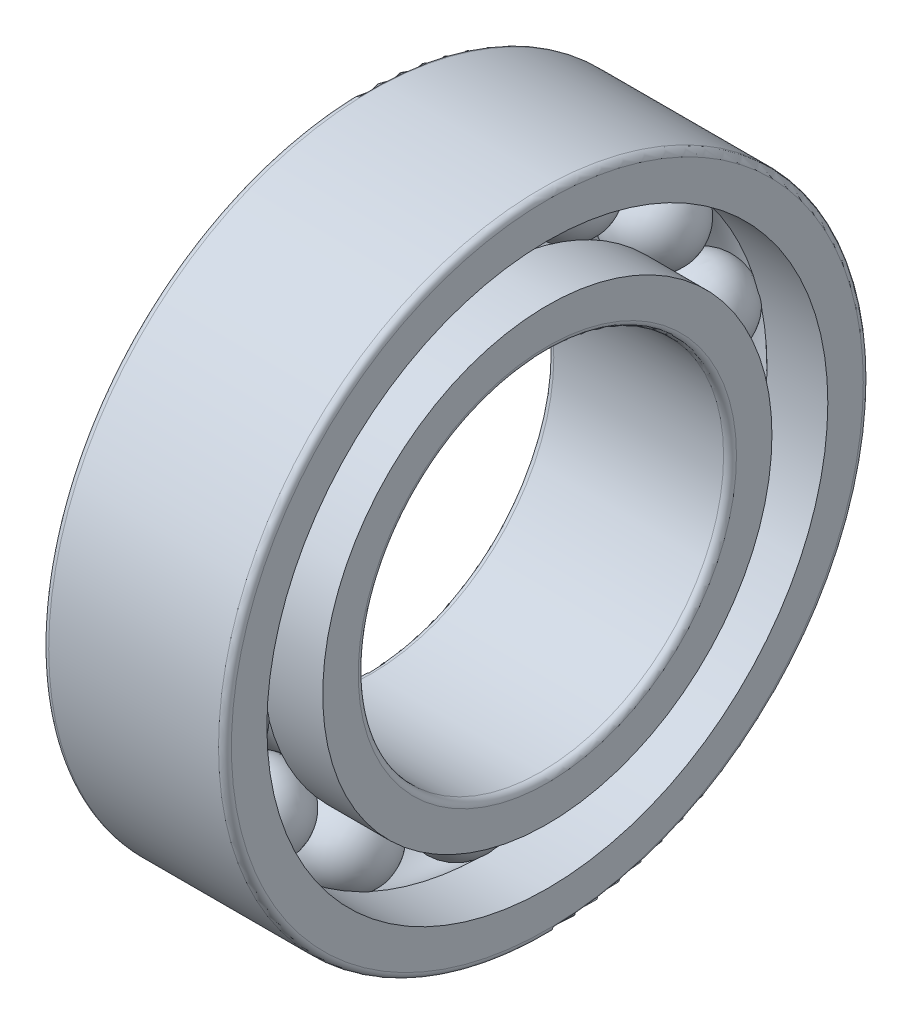
from build123d import *

# Parameters (mm, degrees)
CAGSPISKE_W         = 0.39
CAGSPISKE_H         = 0.65
CAGESPINE_ANGLE     = 0.001
BALLSDETAILED_COUNT = 14
BALLSDETAILED_ANGLE = 334.285714286


with BuildPart() as part:
    # CagSpiSke → CageSpine (revolve)
    with BuildSketch(Plane.XY):
        with Locations((0, 11.75)):
            Rectangle(CAGSPISKE_W, CAGSPISKE_H)
    revolve(axis=Axis((-20.6375, 0, 0), (-1, 0, 0)), revolution_arc=CAGESPINE_ANGLE)

    # BalDetSke → BallDetailed (revolve)
    with BuildSketch(Plane.XY):
        with BuildLine():
            Line((-1.95, 11.75), (1.95, 11.75))
            ThreePointArc((1.95, 11.75), (0, 9.8), (-1.95, 11.75))
        make_face()
    balldetailed = revolve(axis=Axis((-1.905, 11.75, 0), (1, 0, 0)))

    # InnRacSke → InnerRace (revolve)
    with BuildSketch(Plane.XY):
        with BuildLine():
            Line((-1.419727086, 10.45), (-4.25, 10.45))
            Line((-4.25, 10.45), (-4.25, 8.8))
            ThreePointArc((-4.25, 8.8), (-4.162132034, 8.587867966), (-3.95, 8.5))
            Line((-3.95, 8.5), (3.95, 8.5))
            ThreePointArc((3.95, 8.5), (4.162132034, 8.587867966), (4.25, 8.8))
            Line((4.25, 8.8), (4.25, 10.45))
            Line((4.25, 10.45), (1.419727086, 10.45))
            ThreePointArc((1.419727086, 10.45), (0, 9.825), (-1.419727086, 10.45))
        make_face()
    revolve(axis=Axis((-20.6375, 0, 0), (1, 0, 0)))

    # OutRacSke → OuterRace (revolve)
    with BuildSketch(Plane.XY):
        with BuildLine():
            Line((-1.419727086, 13.05), (-4.25, 13.05))
            Line((-4.25, 13.05), (-4.25, 14.7))
            ThreePointArc((-4.25, 14.7), (-4.162132034, 14.912132034), (-3.95, 15))
            Line((-3.95, 15), (3.95, 15))
            ThreePointArc((3.95, 15), (4.162132034, 14.912132034), (4.25, 14.7))
            Line((4.25, 14.7), (4.25, 13.05))
            Line((4.25, 13.05), (1.419727086, 13.05))
            ThreePointArc((1.419727086, 13.05), (0, 13.675), (-1.419727086, 13.05))
        make_face()
    revolve(axis=Axis((-20.6375, 0, 0), (1, 0, 0)))

    # BallsDetailed: BallDetailed ×14 about axis
    ballsdetailed_axis = Axis((-50, 0, 0), (1, 0, 0))
    for i in range(1, BALLSDETAILED_COUNT):
        add(balldetailed.rotate(ballsdetailed_axis, i * BALLSDETAILED_ANGLE / (BALLSDETAILED_COUNT - 1)))


solid = part.part
